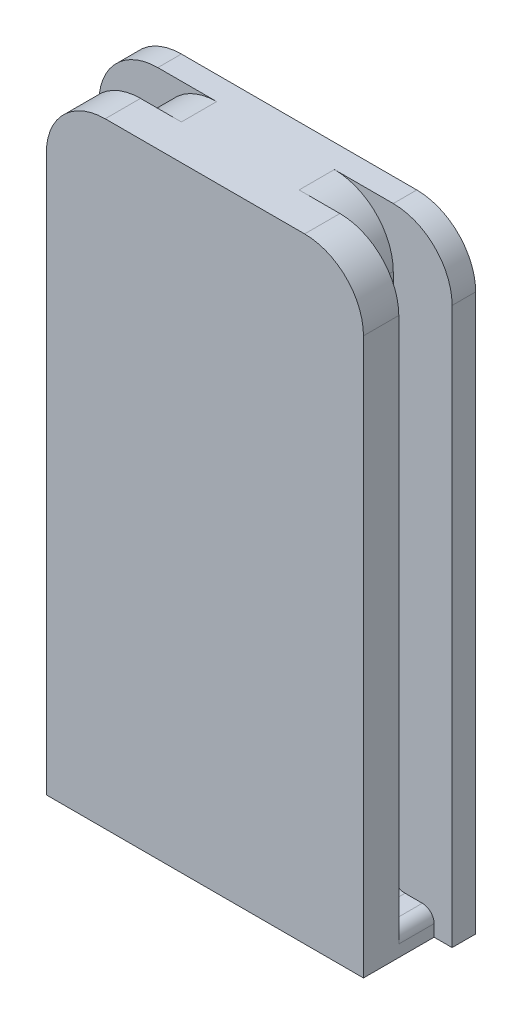
from build123d import *

# Parameters (mm, degrees)
BOSS_EXTRUDE1_DEPTH = 52.243773639
SKETCH2_W           = 26.940383964
SKETCH2_H           = 5.525205864
BOSS_EXTRUDE2_DEPTH = 2
FILLET1_R           = 5
FILLET3_R           = 1
FILLET4_R           = 5
SKETCH3_R           = 3.508090029
BOSS_EXTRUDE3_DEPTH = 2
FILLET5_R           = 5
FILLET6_R           = 5


# Some blends are built 0.0001 mm under size
with BuildPart() as part:
    # Sketch1 → Boss-Extrude1 (new body)
    with BuildSketch(Plane(origin=(0, 0, 0), x_dir=(1, 0, 0), z_dir=(0, 1, 0))):
        Polygon((13.470191982, 0), (-13.470191982, 0), (-13.470191982, 3), (-10, 3), (-10, 6), (-15, 6), (-15, 8), (15, 8), (15, 6), (10, 6), (10, 3), (13.470191982, 3), align=None)
    extrude(amount=BOSS_EXTRUDE1_DEPTH)

    # Sketch2 → Boss-Extrude2 (add)
    with BuildSketch(Plane.XZ):
        with Locations((0, -4.262602932)):
            Rectangle(SKETCH2_W, SKETCH2_H)
    extrude(amount=-BOSS_EXTRUDE2_DEPTH)

    # Fillet1
    fillet1_edges = [part.edges().sort_by_distance(p)[0] for p in [
        (10, 52.243773639, -4.5),
        (-10, 52.243773639, -4.5),
        (-15, 52.243773639, -7),
        (15, 52.243773639, -7),
    ]]
    fillet(fillet1_edges, radius=FILLET1_R - 0.0001)  # a hair under: the kernel refuses the full size

    # Fillet3
    fillet3_edges = [part.edges().sort_by_distance(p)[0] for p in [
        (13.470191982, 2, -4.5),
        (-13.470191982, 2, -4.5),
        (10, 2, -4.5),
        (-10, 2, -4.5),
    ]]
    fillet(fillet3_edges, radius=FILLET3_R)

    # Fillet4
    fillet4_edges = [part.edges().sort_by_distance(p)[0] for p in [
        (13.470191982, 52.243773639, -1.5),
        (-13.470191982, 52.243773639, -1.5),
    ]]
    fillet(fillet4_edges, radius=FILLET4_R)

    # Sketch3 → Boss-Extrude3 (add)
    with BuildSketch(Plane(origin=(0, 0, -8), x_dir=(-1, 0, 0), z_dir=(0, 0, -1))):
        with Locations(Location((0, 32, 0), (0, 0, 180))):
            Circle(SKETCH3_R)
    extrude(amount=BOSS_EXTRUDE3_DEPTH)

    # Fillet5
    # the kernel refuses this fillet: 5 mm, written as the material it adds along each edge
    with BuildSketch(Plane(origin=(0, 32, -8), x_dir=(1, 0, 0), z_dir=(0, 1, 0))) as fillet5_piece_1:
        with BuildLine():
            CenterArc((7.508090029, 5), FILLET5_R, 216.869897646, 53.130102354)
            Line((3.508090029, 2), (3.428090029, 1.94))
            ThreePointArc((3.428090029, 1.94), (3.408090029, 1), (3.408090029, 0))
            Line((3.408090029, 0), (3.508090029, -0.1))
            Line((3.508090029, -0.1), (7.508090029, -0.1))
            Line((7.508090029, -0.1), (7.508090029, 0))
        make_face()
    revolve(axis=Axis((0, 32, -8), (0, 0, -1)))

    # Fillet6
    fillet6_edges = [part.edges().sort_by_distance(p)[0] for p in [
        (-3.508090029, 32, -10),
    ]]
    fillet(fillet6_edges, radius=FILLET6_R)


solid = part.part
